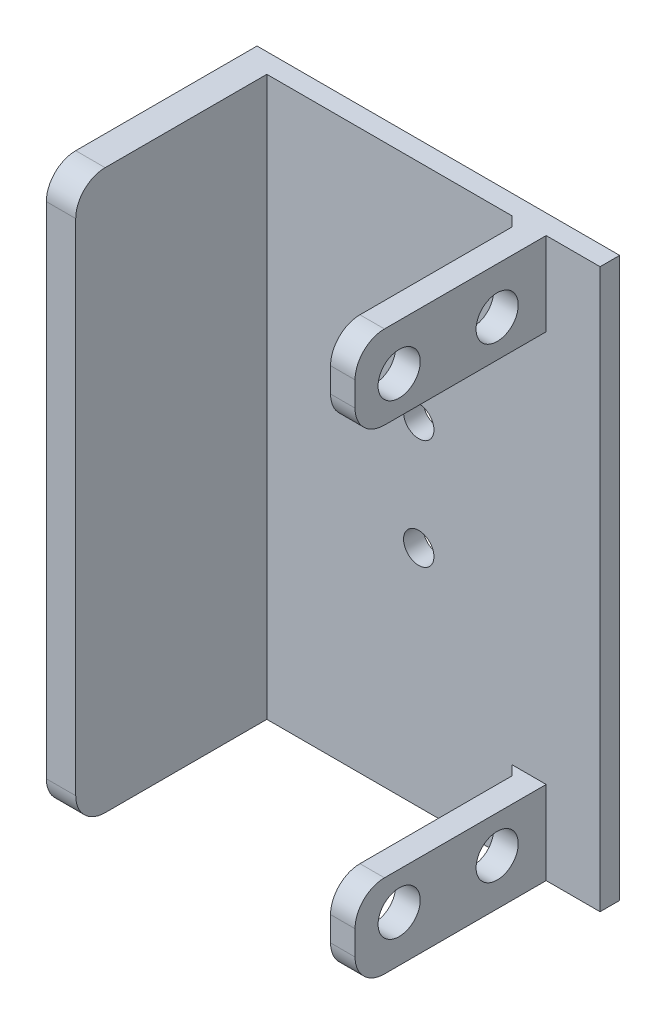
from build123d import *

# Parameters (mm, degrees)
SKETCH_1_W          = 37
SKETCH_1_H          = 57
EXTRUDE_1_DEPTH     = 2
SKETCH_2_W          = 3
SKETCH_2_H          = 57
EXTRUDE_2_DEPTH     = 19.5
SKETCH_3_W          = 2.5
SKETCH_3_H          = 8.5
EXTRUDE_3_DEPTH     = 19.5
SKETCH_4_R          = 1.55
CUT_EXTRUDE_1_DEPTH = 40.17588544
SKETCH_6_R          = 2.5
EXTRUDE_4_DEPTH     = 7
SKETCH_7_R          = 2.15
CUT_EXTRUDE_2_DEPTH = 3
FILLET_1_R          = 3
CHAMFER_2_SIZE      = 1


with BuildPart() as part:
    # 草图1 → 凸台-拉伸1 (new body)
    with BuildSketch(Plane.XY):
        Rectangle(SKETCH_1_W, SKETCH_1_H)
    extrude(amount=EXTRUDE_1_DEPTH)

    # 草图2 → 凸台-拉伸2 (add)
    with BuildSketch(Plane.XY.offset(2)):
        with Locations((-17, 0)):
            Rectangle(SKETCH_2_W, SKETCH_2_H)
    extrude(amount=EXTRUDE_2_DEPTH)

    # 草图3 → 凸台-拉伸3 (add)
    with BuildSketch(Plane.XY.offset(2)):
        with Locations((11.75, -24.25)):
            Rectangle(SKETCH_3_W, SKETCH_3_H)
        with Locations((11.75, 24.25)):
            Rectangle(SKETCH_3_W, SKETCH_3_H)
    extrude(amount=EXTRUDE_3_DEPTH)

    # 草图4 → 切除-拉伸1 (cut, through all)
    with BuildSketch(Plane.XY.offset(2)):
        with Locations((0, -5.6)):
            Circle(SKETCH_4_R)
        with Locations((0, 5.6)):
            Circle(SKETCH_4_R)
    extrude(amount=-CUT_EXTRUDE_1_DEPTH, mode=Mode.SUBTRACT)

    # 草图6 → 凸台-拉伸4 (add)
    with BuildSketch(Plane.ZY.offset(18.5)):
        with Locations((11.5, -9.9)):
            Circle(SKETCH_6_R)
    extrude(amount=EXTRUDE_4_DEPTH)

    # 草图7 → 切除-拉伸2 (cut)
    with BuildSketch(Plane(origin=(13, 0, 0), x_dir=(0, 0, -1), z_dir=(1, 0, 0))):
        with Locations((-17, -23.793044535)):
            Circle(SKETCH_7_R)
        with Locations((-7, -23.793044535)):
            Circle(SKETCH_7_R)
        with Locations((-7, 23.793044535)):
            Circle(SKETCH_7_R)
        with Locations((-17, 23.793044535)):
            Circle(SKETCH_7_R)
    extrude(amount=-CUT_EXTRUDE_2_DEPTH, mode=Mode.SUBTRACT)

    # 圆角1
    fillet_1_edges = [part.edges().sort_by_distance(p)[0] for p in [
        (11.75, 28.5, 21.5),
        (11.75, -20, 21.5),
        (11.75, 20, 21.5),
        (11.75, -28.5, 21.5),
        (-17, -28.5, 21.5),
        (-17, 28.5, 21.5),
    ]]
    fillet(fillet_1_edges, radius=FILLET_1_R)

    # 倒角2
    chamfer_2_edges = [part.edges().sort_by_distance(p)[0] for p in [
        (10.5, -24.25, 2),
        (10.5, 24.25, 2),
    ]]
    chamfer(chamfer_2_edges, length=CHAMFER_2_SIZE)


solid = part.part
